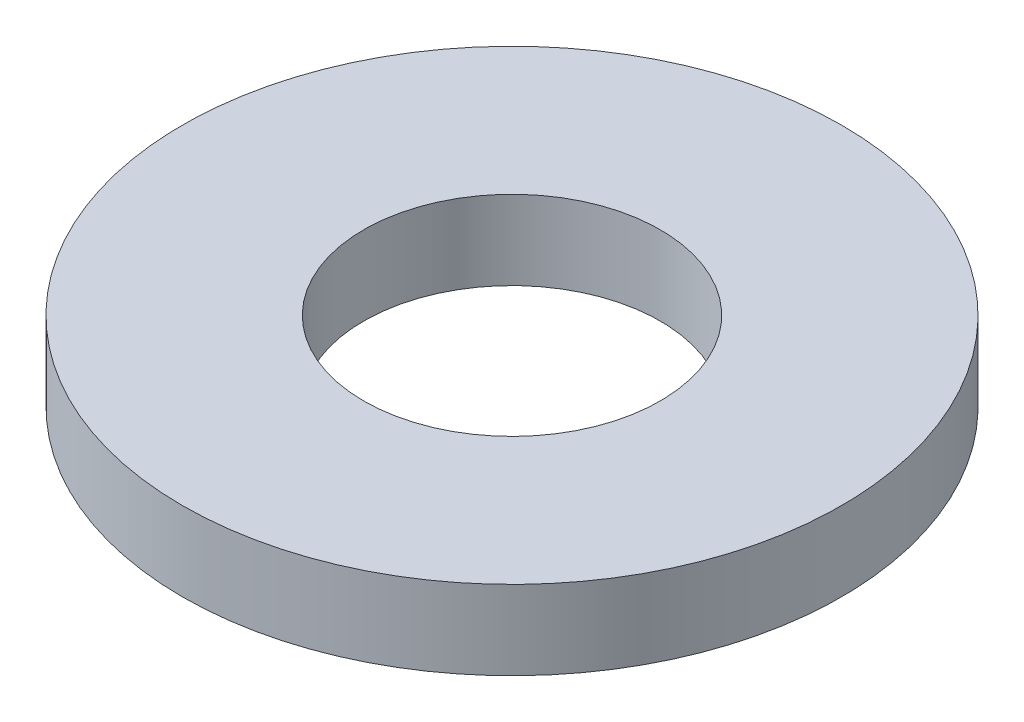
from build123d import *

# Parameters (mm, degrees)
SKETCH1_R           = 100
BOSS_EXTRUDE1_DEPTH = 24
SKETCH2_R           = 45
CUT_EXTRUDE1_DEPTH  = 144.443368616


with BuildPart() as part:
    # Sketch1 → Boss-Extrude1 (new body)
    with BuildSketch(Plane(origin=(0, 0, 0), x_dir=(1, 0, 0), z_dir=(0, 1, 0))):
        Circle(SKETCH1_R)
    extrude(amount=BOSS_EXTRUDE1_DEPTH)

    # Sketch2 → Cut-Extrude1 (cut, through all)
    with BuildSketch(Plane(origin=(0, 0, 0), x_dir=(1, 0, 0), z_dir=(0, 1, 0))):
        Circle(SKETCH2_R)
    extrude(amount=CUT_EXTRUDE1_DEPTH, mode=Mode.SUBTRACT)


solid = part.part
